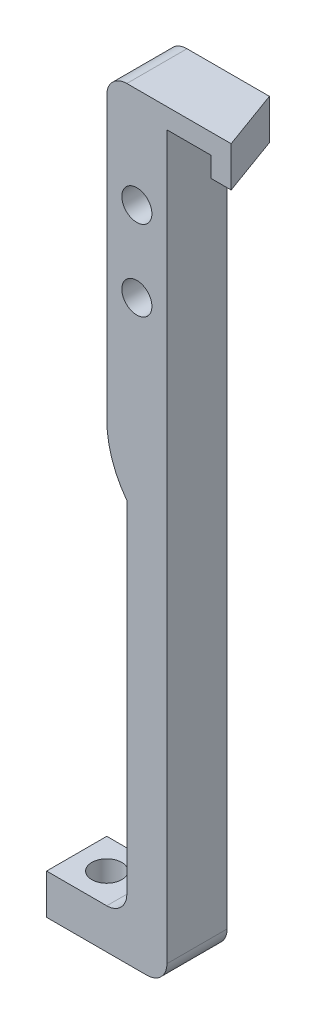
from build123d import *

# Parameters (mm, degrees)
SKETCH1_W             = 7.62
SKETCH1_H             = 96.52
BOSS_EXTRUDE1_DEPTH   = 7.62
SKETCH2_W             = 7.62
SKETCH2_H             = 5.08
BOSS_EXTRUDE2_DEPTH   = 7.62
SKETCH4_W             = 7.62
SKETCH4_H             = 2.54
BOSS_EXTRUDE3_DEPTH   = 8.128
BOSS_EXTRUDE4_DEPTH   = 2.54
F_6_CLEARANCE_HOLE1_D = 3.7973
CUT_EXTRUDE1_DEPTH    = 2.54
SKETCH12_W            = 7.62
SKETCH12_H            = 45.72
CUT_EXTRUDE2_DEPTH    = 2.54
FILLET2_R             = 12.7
FILLET3_R             = 2.54
SKETCH14_R            = 1.905
CUT_EXTRUDE4_DEPTH    = 99.092682214


with BuildPart() as part:
    # Sketch1 → Boss-Extrude1 (new body)
    with BuildSketch(Plane(origin=(0, 0, 0), x_dir=(0, 0, -1), z_dir=(1, 0, 0))):
        with Locations((3.81, 48.26)):
            Rectangle(SKETCH1_W, SKETCH1_H)
    extrude(amount=BOSS_EXTRUDE1_DEPTH)

    # Sketch2 → Boss-Extrude2 (add)
    with BuildSketch(Plane.ZY):
        with Locations((-3.81, 2.54)):
            Rectangle(SKETCH2_W, SKETCH2_H)
    extrude(amount=BOSS_EXTRUDE2_DEPTH)

    # Sketch4 → Boss-Extrude3 (add)
    with BuildSketch(Plane(origin=(7.62, 0, 0), x_dir=(0, 0, -1), z_dir=(1, 0, 0))):
        with Locations((3.81, 95.25)):
            Rectangle(SKETCH4_W, SKETCH4_H)
    extrude(amount=BOSS_EXTRUDE3_DEPTH)

    # Sketch5 → Boss-Extrude4 (add)
    with BuildSketch(Plane.XZ.offset(-93.98)):
        Polygon((15.748, 0), (12.974546815, -7.62), (10.434546815, -7.62), (13.208, 0), align=None)
    extrude(amount=BOSS_EXTRUDE4_DEPTH)

    # #6 Clearance Hole1 (through all)
    with Locations(Plane(origin=(0, 5.08, 0), x_dir=(1, 0, 0), z_dir=(0, 1, 0))):
        with Locations((-3.81, 3.81)):
            Hole(F_6_CLEARANCE_HOLE1_D / 2)

    # Sketch8 → Cut-Extrude1 (cut)
    with BuildSketch(Plane.XZ.offset(-93.98)):
        Polygon((15.748, -7.62), (12.974546815, -7.62), (15.748, 0), align=None)
    extrude(amount=-CUT_EXTRUDE1_DEPTH, mode=Mode.SUBTRACT)

    # Sketch12 → Cut-Extrude2 (cut)
    with BuildSketch(Plane.ZY):
        with Locations((-3.81, 27.94)):
            Rectangle(SKETCH12_W, SKETCH12_H)
    extrude(amount=-CUT_EXTRUDE2_DEPTH, mode=Mode.SUBTRACT)

    # Fillet2
    # the kernel refuses this fillet: 12.7 mm, written as the material it takes off along each edge
    with BuildSketch(Plane(origin=(0, 50.8, 19.05), x_dir=(1, 0, 0), z_dir=(0, 0, -1))) as fillet2_piece_1:
        with BuildLine():
            CenterArc((12.7, -7.62), FILLET2_R, 143.130102354, 36.869897646)
            Line((0, -7.62), (-0.254, -7.62))
            Line((-0.254, -7.62), (-0.254, 0))
            Line((-0.254, 0), (0, 0.254))
            ThreePointArc((0, 0.254), (1.27, 0.254), (2.3368, 0.1524))
            Line((2.3368, 0.1524), (2.54, 0))
        make_face()
    extrude(amount=45.72, mode=Mode.SUBTRACT)

    # Fillet3
    fillet3_edges = [part.edges().sort_by_distance(p)[0] for p in [
        (2.54, 5.08, -3.81),
        (7.62, 0, -3.81),
        (0, 96.52, -3.81),
    ]]
    fillet(fillet3_edges, radius=FILLET3_R)

    # Sketch14 → Cut-Extrude4 (cut, through all)
    with BuildSketch(Plane.XY):
        with Locations((3.81, 83.82)):
            Circle(SKETCH14_R)
        with Locations((3.81, 73.66)):
            Circle(SKETCH14_R)
    extrude(amount=-CUT_EXTRUDE4_DEPTH, mode=Mode.SUBTRACT)


solid = part.part
